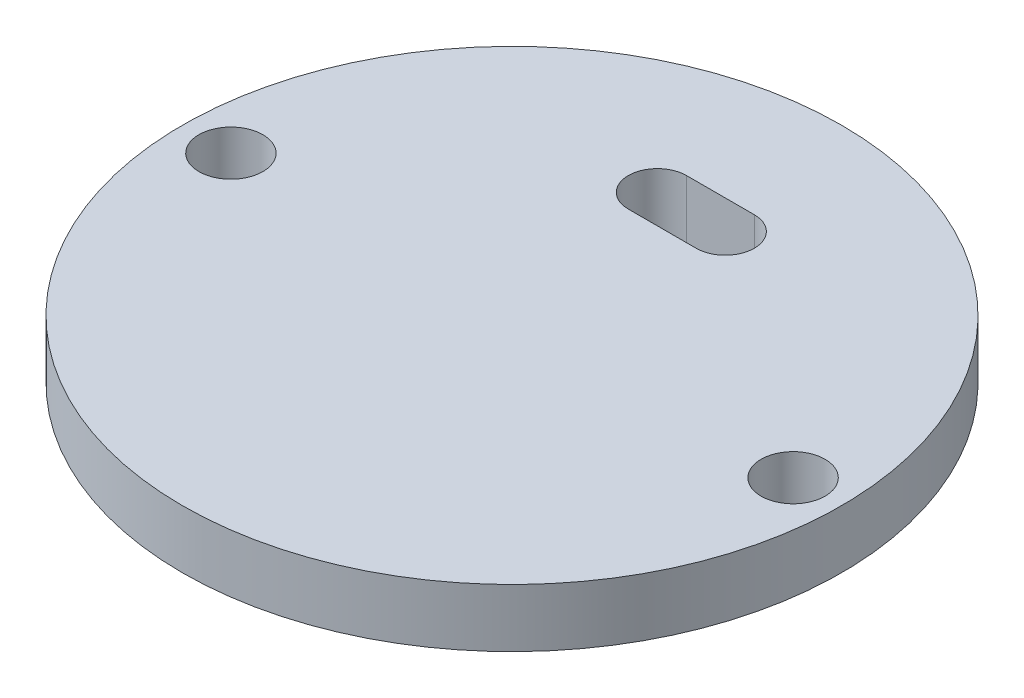
from build123d import *

# Parameters (mm, degrees)
SKETCH1_R           = 17
SKETCH1_R_2         = 1.65
BOSS_EXTRUDE1_DEPTH = 3


with BuildPart() as part:
    # Sketch1 → Boss-Extrude1 (new body)
    with BuildSketch(Plane(origin=(0, 0, 0), x_dir=(1, 0, 0), z_dir=(0, 1, 0))):
        Circle(SKETCH1_R)
        with Locations((-14.5, 0)):
            Circle(SKETCH1_R_2, mode=Mode.SUBTRACT)
        with Locations((14.5, 0)):
            Circle(SKETCH1_R_2, mode=Mode.SUBTRACT)
        with BuildLine():
            Line((-1.75, 7.75), (1.75, 7.75))
            ThreePointArc((1.75, 7.75), (3.25, 9.25), (1.75, 10.75))
            Line((1.75, 10.75), (-1.75, 10.75))
            ThreePointArc((-1.75, 10.75), (-3.25, 9.25), (-1.75, 7.75))
        make_face(mode=Mode.SUBTRACT)
    extrude(amount=BOSS_EXTRUDE1_DEPTH)


solid = part.part
